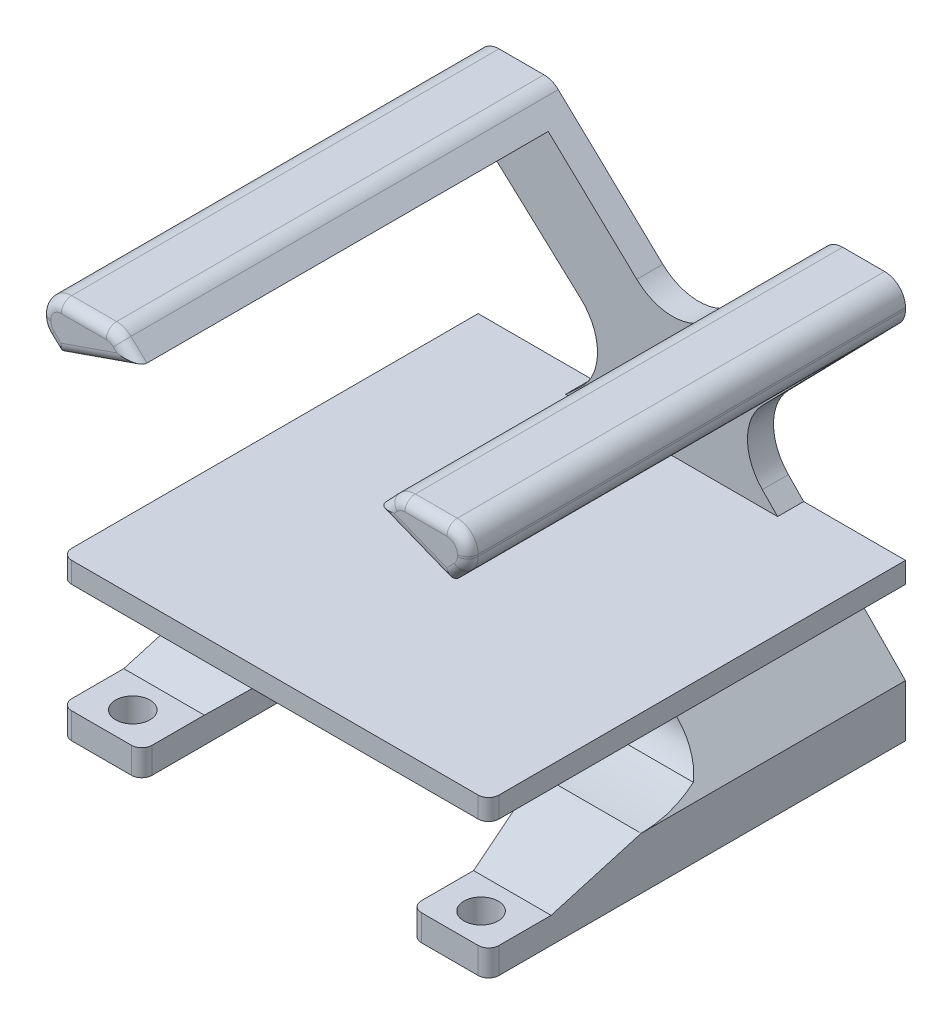
from build123d import *
from OCP.BRepFilletAPI import BRepFilletAPI_MakeChamfer

# Parameters (mm, degrees)
BOSS_EXTRUDE1_DEPTH = 40
SKETCH3_W           = 37.5
SKETCH3_H           = 21
SKETCH3_W_2         = 41
SKETCH3_H_2         = 2
CUT_EXTRUDE1_DEPTH  = 37.5
SKETCH4_W           = 50.283363854
SKETCH4_H           = 54.333359839
CUT_EXTRUDE2_DEPTH  = 37.5
BOSS_EXTRUDE2_DEPTH = 2
SKETCH6_W           = 30
SKETCH6_H           = 8
CUT_EXTRUDE3_DEPTH  = 100
CHAMFER1_SIZE       = 10
CHAMFER1_SIZE2      = 5.773502692
FILLET2_R           = 20
FILLET3_R           = 4
FILLET4_R           = 5
CUT_EXTRUDE4_DEPTH  = 100
BOSS_EXTRUDE3_REACH = 51.556
SKETCH9_R           = 1.65
CUT_EXTRUDE5_DEPTH  = 100
SKETCH10_W          = 7
SKETCH10_H          = 2.5
BOSS_EXTRUDE4_DEPTH = 5
SKETCH11_R          = 1.65
CUT_EXTRUDE6_DEPTH  = 5
FILLET5_R           = 1
FILLET6_R           = 1
FILLET7_R           = 2
FILLET8_R           = 1
FILLET9_R           = 1


with BuildPart() as part:
    # Sketch2 → Boss-Extrude1 (new body)
    with BuildSketch(Plane.XY):
        Polygon((-2.179971033, -7), (-16.349782749, -20), (-21.349782749, -20), (-21.349782749, -15), (-12.629898616, -7), (-21.349782749, -7), (-21.349782749, -5), (-10.449927583, -5), (-5, 0), (-21.349782749, 15), (-21.349782749, 20), (-16.349782749, 20), (0, 4.52331207), (14.650217251, 20), (19.650217251, 20), (19.650217251, 15), (5, 0), (9.88340575, -5), (19.650217251, -5), (19.650217251, -7), (11.83676805, -7), (19.650217251, -15), (19.650217251, -20), (14.650217251, -20), (1.9533623, -7), align=None)
    extrude(amount=BOSS_EXTRUDE1_DEPTH)

    # Sketch3 → Cut-Extrude1 (cut)
    with BuildSketch(Plane.XY.offset(40)):
        with Locations((-0.849782749, 5.5)):
            Rectangle(SKETCH3_W, SKETCH3_H)
        with Locations((-0.849782749, 19)):
            Rectangle(SKETCH3_W_2, SKETCH3_H_2)
    extrude(amount=-CUT_EXTRUDE1_DEPTH, mode=Mode.SUBTRACT)

    # Sketch4 → Cut-Extrude2 (cut)
    with BuildSketch(Plane(origin=(0, 18, 0), x_dir=(1, 0, 0), z_dir=(0, 1, 0))):
        with Locations((3.791899178, 24.66667992)):
            Rectangle(SKETCH4_W, SKETCH4_H)
    extrude(amount=CUT_EXTRUDE2_DEPTH, mode=Mode.SUBTRACT)

    # Sketch5 → Boss-Extrude2 (add)
    with BuildSketch(Plane.XY.offset(40)):
        Polygon((-21.349782749, 15), (-19.599782749, 13.394474079), (-12.124128572, 16), (-14.236955661, 18), (-21.349782749, 18), align=None)
        Polygon((10.863821268, 16), (12.75701926, 18), (19.650217251, 18), (19.650217251, 15), (17.900217251, 13.208217697), align=None)
    extrude(amount=BOSS_EXTRUDE2_DEPTH)

    # Sketch6 → Cut-Extrude3 (cut)
    with BuildSketch(Plane(origin=(19.650217251, 0, 0), x_dir=(0, 0, -1), z_dir=(1, 0, 0))):
        with Locations((-25, -11)):
            Rectangle(SKETCH6_W, SKETCH6_H)
    extrude(amount=-CUT_EXTRUDE3_DEPTH, mode=Mode.SUBTRACT)

    # Chamfer1: one chamfer whose edges measure the first distance from different faces: ONE call of the kernel's chamfer builder (chamfer() names one face for all edges)
    chamfer1_edges_1 = [part.edges().sort_by_distance(p)[0] for p in [
        (-16.124818958, -15, 10),
    ]]
    chamfer1_side_1 = [part.faces().sort_by_distance(p)[0] for p in [
        (-16.124818958, -15, 25),
    ]]
    chamfer1_edges_2 = [part.edges().sort_by_distance(p)[0] for p in [
        (14.708514376, -15, 10),
    ]]
    chamfer1_side_2 = [part.faces().sort_by_distance(p)[0] for p in [
        (14.708514376, -15, 25),
    ]]
    chamfer1 = BRepFilletAPI_MakeChamfer(part.part.solid().wrapped)
    for e in chamfer1_edges_1:
        chamfer1.Add(CHAMFER1_SIZE, CHAMFER1_SIZE2, e.wrapped, chamfer1_side_1[0].wrapped)  # the first distance lies on this face
    for e in chamfer1_edges_2:
        chamfer1.Add(CHAMFER1_SIZE, CHAMFER1_SIZE2, e.wrapped, chamfer1_side_2[0].wrapped)  # the first distance lies on this face
    add(Compound.cast(chamfer1.Shape()), mode=Mode.REPLACE)

    # Fillet2
    # the kernel refuses this fillet: 20 mm, written as the material it adds along each edge
    with BuildSketch(Plane(origin=(14.02999004, -9.226497308, 10), x_dir=(0, 1, 0), z_dir=(-1, 0, 0))) as fillet2_piece_1_section:
        with BuildLine():
            CenterArc((13.593145897, -16.455980671), FILLET2_R, 124.634022664, 25.365977336)
            Line((-3.727362178, -6.455980671), (0, 0))
            Line((0, 0), (2.226497308, 0))
        make_face()
    fillet2_piece_1 = extrude(amount=47.723549367, mode=Mode.PRIVATE)
    fillet2_piece_1 = split(fillet2_piece_1, bisect_by=Plane(origin=(14.020448108, -9.235816733, 10), z_dir=(-0.7153987205247665, -0.6987164451131282, 0)), keep=Keep.TOP, mode=Mode.PRIVATE)
    fillet2_piece_1 = split(fillet2_piece_1, bisect_by=Plane(origin=(8.962167208, -14.17614434, 10), z_dir=(0.7153987205247687, 0.6987164451131259, 0)), keep=Keep.TOP, mode=Mode.PRIVATE)
    add(fillet2_piece_1)
    with BuildSketch(Plane(origin=(14.02999004, -9.226497308, 10), x_dir=(0, 1, 0), z_dir=(-1, 0, 0))) as fillet2_piece_2_section:
        with BuildLine():
            CenterArc((13.593145897, -16.455980671), FILLET2_R, 124.634022664, 25.365977336)
            Line((-3.727362178, -6.455980671), (0, 0))
            Line((0, 0), (2.226497308, 0))
        make_face()
    fillet2_piece_2 = extrude(amount=47.723549367, mode=Mode.PRIVATE)
    fillet2_piece_2 = split(fillet2_piece_2, bisect_by=Plane(origin=(5.512518344, 0.057423479, 10), z_dir=(-0.6760355748646789, 0.7368689853137959, 0)), keep=Keep.TOP, mode=Mode.PRIVATE)
    fillet2_piece_2 = split(fillet2_piece_2, bisect_by=Plane(origin=(0.736649611, 5.263051227, 10), z_dir=(0.6760355748646789, -0.7368689853137959, 0)), keep=Keep.TOP, mode=Mode.PRIVATE)
    add(fillet2_piece_2)
    with BuildSketch(Plane(origin=(2.497604455, -15, 20), x_dir=(0, 0.5000000000000009, -0.866025403784438), z_dir=(-1, 0, 0))) as fillet2_piece_3_section:
        with BuildLine():
            CenterArc((FILLET2_R * 0.267949192431, -FILLET2_R), FILLET2_R, 90, 30)
            Line((-FILLET2_R * 0.232050807569, -FILLET2_R * 0.133974596216), (0, 0))
            Line((0, 0), (FILLET2_R * 0.267949192431, 0))
        make_face()
    fillet2_piece_3 = extrude(amount=37.244846826, mode=Mode.PRIVATE)
    fillet2_piece_3 = split(fillet2_piece_3, bisect_by=Plane(origin=(-3.62535745, -8.326060204, 20), z_dir=(-0.6760355748646789, 0.7368689853137959, 0)), keep=Keep.TOP, mode=Mode.PRIVATE)
    fillet2_piece_3 = split(fillet2_piece_3, bisect_by=Plane(origin=(-8.401226183, -3.120432456, 20), z_dir=(0.6760355748646789, -0.7368689853137959, 0)), keep=Keep.TOP, mode=Mode.PRIVATE)
    add(fillet2_piece_3)
    with BuildSketch(Plane(origin=(32.648156894, -9.226497308, 10), x_dir=(0, -0.5000000000000011, 0.8660254037844379), z_dir=(-1, 0, 0))) as fillet2_piece_4_section:
        with BuildLine():
            CenterArc((7.454724357, 20), FILLET2_R, 244.634022664, 25.365977336)
            Line((-1.113248654, 1.92820323), (0, 0))
            Line((0, 0), (7.454724357, 0))
        make_face()
    fillet2_piece_4 = extrude(amount=47.157027534, mode=Mode.PRIVATE)
    fillet2_piece_4 = split(fillet2_piece_4, bisect_by=Plane(origin=(23.109924126, -18.542309458, 10), z_dir=(-0.7153987205247665, -0.6987164451131282, 0)), keep=Keep.TOP, mode=Mode.PRIVATE)
    fillet2_piece_4 = split(fillet2_piece_4, bisect_by=Plane(origin=(18.051643225, -23.482637065, 10), z_dir=(0.7153987205247687, 0.6987164451131259, 0)), keep=Keep.TOP, mode=Mode.PRIVATE)
    add(fillet2_piece_4)
    with BuildSketch(Plane(origin=(32.648156894, -9.226497308, 10), x_dir=(0, -0.5000000000000011, 0.8660254037844379), z_dir=(-1, 0, 0))) as fillet2_piece_5_section:
        with BuildLine():
            CenterArc((7.454724357, 20), FILLET2_R, 244.634022664, 25.365977336)
            Line((-1.113248654, 1.92820323), (0, 0))
            Line((0, 0), (7.454724357, 0))
        make_face()
    fillet2_piece_5 = extrude(amount=47.157027534, mode=Mode.PRIVATE)
    fillet2_piece_5 = split(fillet2_piece_5, bisect_by=Plane(origin=(15.621734276, 9.332056745, 10), z_dir=(-0.6760355748646789, 0.7368689853137959, 0)), keep=Keep.TOP, mode=Mode.PRIVATE)
    fillet2_piece_5 = split(fillet2_piece_5, bisect_by=Plane(origin=(10.845865543, 14.537684493, 10), z_dir=(0.6760355748646789, -0.7368689853137959, 0)), keep=Keep.TOP, mode=Mode.PRIVATE)
    add(fillet2_piece_5)
    with BuildSketch(Plane(origin=(33.047676872, -15, 20), x_dir=(0, 0.5000000000000009, -0.866025403784438), z_dir=(-1, 0, 0))) as fillet2_piece_6_section:
        with BuildLine():
            CenterArc((FILLET2_R * 0.267949192431, -FILLET2_R), FILLET2_R, 90, 30)
            Line((-FILLET2_R * 0.232050807569, -FILLET2_R * 0.133974596216), (0, 0))
            Line((0, 0), (FILLET2_R * 0.267949192431, 0))
        make_face()
    fillet2_piece_6 = extrude(amount=36.678324993, mode=Mode.PRIVATE)
    fillet2_piece_6 = split(fillet2_piece_6, bisect_by=Plane(origin=(26.190919613, -21.696865566, 20), z_dir=(-0.7153987205247665, -0.6987164451131282, 0)), keep=Keep.TOP, mode=Mode.PRIVATE)
    fillet2_piece_6 = split(fillet2_piece_6, bisect_by=Plane(origin=(21.132638712, -26.637193173, 20), z_dir=(0.7153987205247687, 0.6987164451131259, 0)), keep=Keep.TOP, mode=Mode.PRIVATE)
    add(fillet2_piece_6)

    # Fillet3
    # the kernel refuses this fillet: 4 mm, written as the material it adds along each edge
    with BuildSketch(Plane(origin=(45.374542852, -7, 10), x_dir=(0, -0.5845395374156303, 0.8113652255291207), z_dir=(-1, 0, 0))) as fillet3_piece_1_section:
        with BuildLine():
            CenterArc((12.073598928, 3.768334945), FILLET3_R, 125.7704671, 163.825043137)
            Line((9.735440779, 7.013795847), (0, 0))
            ThreePointArc((0, 0), (6.70755496, -1.158325275), (13.41510992, 0))
        make_face()
    fillet3_piece_1 = extrude(amount=76.958955353, mode=Mode.PRIVATE)
    fillet3_piece_1 = split(fillet3_piece_1, bisect_by=Plane(origin=(23.151785451, -28.704548255, 10), z_dir=(0.7153987205249446, 0.6987164451129458, 0)), keep=Keep.TOP, mode=Mode.PRIVATE)
    fillet3_piece_1 = split(fillet3_piece_1, bisect_by=Plane(origin=(28.210066352, -23.764220648, 10), z_dir=(-0.7153987205249446, -0.6987164451129458, 0)), keep=Keep.TOP, mode=Mode.PRIVATE)
    add(fillet3_piece_1)
    with BuildSketch(Plane(origin=(45.374542852, -7, 10), x_dir=(0, -0.5845395374156303, 0.8113652255291207), z_dir=(-1, 0, 0))) as fillet3_piece_2_section:
        with BuildLine():
            CenterArc((12.073598928, 3.768334945), FILLET3_R, 125.7704671, 163.825043137)
            Line((9.735440779, 7.013795847), (0, 0))
            ThreePointArc((0, 0), (6.70755496, -1.158325275), (13.41510992, 0))
        make_face()
    fillet3_piece_2 = extrude(amount=76.958955353, mode=Mode.PRIVATE)
    fillet3_piece_2 = split(fillet3_piece_2, bisect_by=Plane(origin=(23.640984015, 16.689264357, 10), z_dir=(-0.6760355748647515, 0.7368689853137292, 0)), keep=Keep.TOP, mode=Mode.PRIVATE)
    fillet3_piece_2 = split(fillet3_piece_2, bisect_by=Plane(origin=(18.865115282, 21.894892105, 10), z_dir=(0.6760355748647515, -0.7368689853137292, 0)), keep=Keep.TOP, mode=Mode.PRIVATE)
    add(fillet3_piece_2)
    with BuildSketch(Plane(origin=(31.357803768, -7, 10), x_dir=(0, 0, 1), z_dir=(-1, 0, 0))) as fillet3_piece_3_section:
        with BuildLine():
            CenterArc((11.998839083, -4), FILLET3_R, 90, 163.825043137)
            ThreePointArc((10.884553686, -7.841662147), (4.765189923, -4.860655921), (0, 0))
            Line((0, 0), (11.998839083, 0))
        make_face()
    fillet3_piece_3 = extrude(amount=77.525477185, mode=Mode.PRIVATE)
    fillet3_piece_3 = split(fillet3_piece_3, bisect_by=Plane(origin=(16.308747963, -21.698129131, 10), z_dir=(0.7153987205249446, 0.6987164451129458, 0)), keep=Keep.TOP, mode=Mode.PRIVATE)
    fillet3_piece_3 = split(fillet3_piece_3, bisect_by=Plane(origin=(21.367028864, -16.757801523, 10), z_dir=(-0.7153987205249446, -0.6987164451129458, 0)), keep=Keep.TOP, mode=Mode.PRIVATE)
    add(fillet3_piece_3)
    with BuildSketch(Plane(origin=(31.357803768, -7, 10), x_dir=(0, 0, 1), z_dir=(-1, 0, 0))) as fillet3_piece_4_section:
        with BuildLine():
            CenterArc((11.998839083, -4), FILLET3_R, 90, 163.825043137)
            ThreePointArc((10.884553686, -7.841662147), (4.765189923, -4.860655921), (0, 0))
            Line((0, 0), (11.998839083, 0))
        make_face()
    fillet3_piece_4 = extrude(amount=77.525477185, mode=Mode.PRIVATE)
    fillet3_piece_4 = split(fillet3_piece_4, bisect_by=Plane(origin=(11.254363742, 14.912458463, 10), z_dir=(0.6760355748647515, -0.7368689853137292, 0)), keep=Keep.TOP, mode=Mode.PRIVATE)
    fillet3_piece_4 = split(fillet3_piece_4, bisect_by=Plane(origin=(16.030232474, 9.706830715, 10), z_dir=(-0.6760355748647515, 0.7368689853137292, 0)), keep=Keep.TOP, mode=Mode.PRIVATE)
    add(fillet3_piece_4)

    # Fillet4
    fillet4_edges = [part.edges().sort_by_distance(p)[0] for p in [
        (1.9533623, -7, 10.999419542),
        (-2.179971033, -7, 10.999419542),
        (0, 4.52331207, 1.25),
        (-5, 0, 1.25),
        (5, 0, 1.25),
    ]]
    fillet(fillet4_edges, radius=FILLET4_R)

    # Sketch7 → Cut-Extrude4 (cut)
    with BuildSketch(Plane(origin=(19.650217251, 0, 0), x_dir=(0, 0, -1), z_dir=(1, 0, 0))):
        Polygon((-40, -17.5), (-34, -17.5), (-25.358983849, -15), (-40, -15), align=None)
    extrude(amount=-CUT_EXTRUDE4_DEPTH, mode=Mode.SUBTRACT)

    # Boss-Extrude3: up to this face of the body (flat: up to its plane)
    boss_extrude3_end = Plane(part.part.faces().sort_by_distance((-0.697208097, -1.016556484, 0))[0])
    # Sketch8 → Boss-Extrude3 (add, up to the picked face)
    with BuildSketch(Plane.XY.offset(40), mode=Mode.PRIVATE) as boss_extrude3_sk1:
        Polygon((-13.624818958, -17.5), (-16.349782749, -20), (-13.624818958, -20), align=None)
    boss_extrude3_tool1 = split(extrude(boss_extrude3_sk1.sketch, amount=-BOSS_EXTRUDE3_REACH, mode=Mode.PRIVATE), bisect_by=boss_extrude3_end, keep=Keep.BOTH, mode=Mode.PRIVATE)
    # Sketch8 → Boss-Extrude3 (add, up to the picked face)
    with BuildSketch(Plane.XY.offset(40), mode=Mode.PRIVATE) as boss_extrude3_sk2:
        Polygon((14.650217251, -20), (12.208514376, -17.5), (12.208514376, -20), align=None)
    boss_extrude3_tool2 = split(extrude(boss_extrude3_sk2.sketch, amount=-BOSS_EXTRUDE3_REACH, mode=Mode.PRIVATE), bisect_by=boss_extrude3_end, keep=Keep.BOTH, mode=Mode.PRIVATE)
    add(boss_extrude3_tool1.solids().sort_by(Axis((-14.53314, -19.166667, 40), (0, 0, -1)))[0])
    add(boss_extrude3_tool2.solids().sort_by(Axis((13.022415, -19.166667, 40), (0, 0, -1)))[0])

    # Sketch9 → Cut-Extrude5 (cut)
    with BuildSketch(Plane(origin=(0, -17.5, 0), x_dir=(1, 0, 0), z_dir=(0, 1, 0))):
        with Locations(Location((-17.487300853, -37, 0), (0, 0, 270))):
            Circle(SKETCH9_R)
        with Locations(Location((15.929365813, -37, 0), (0, 0, 270))):
            Circle(SKETCH9_R)
    extrude(amount=-CUT_EXTRUDE5_DEPTH, mode=Mode.SUBTRACT)

    # Sketch10 → Boss-Extrude4 (add)
    with BuildSketch(Plane(origin=(0, 0, 0), x_dir=(-1, 0, 0), z_dir=(0, 0, -1))):
        with Locations((10.124818958, -18.75)):
            Rectangle(SKETCH10_W, SKETCH10_H)
        with Locations((-8.708514376, -18.75)):
            Rectangle(SKETCH10_W, SKETCH10_H)
    extrude(amount=-BOSS_EXTRUDE4_DEPTH)

    # Sketch11 → Cut-Extrude6 (cut)
    with BuildSketch(Plane(origin=(0, -17.5, 0), x_dir=(1, 0, 0), z_dir=(0, 1, 0))):
        with Locations(Location((8.208514376, -2.5, 0), (0, 0, 270))):
            Circle(SKETCH11_R)
        with Locations(Location((-9.624818958, -2.5, 0), (0, 0, 270))):
            Circle(SKETCH11_R)
    extrude(amount=-CUT_EXTRUDE6_DEPTH, mode=Mode.SUBTRACT)

    # Fillet5
    fillet5_edges = [part.edges().sort_by_distance(p)[0] for p in [
        (5.208514376, -18.75, 5),
        (-6.624818958, -18.75, 5),
    ]]
    fillet(fillet5_edges, radius=FILLET5_R)

    # Fillet6
    fillet6_edges = [part.edges().sort_by_distance(p)[0] for p in [
        (19.650217251, -6, 40),
        (-21.349782749, -6, 40),
    ]]
    fillet(fillet6_edges, radius=FILLET6_R)

    # Fillet7
    fillet7_edges = [part.edges().sort_by_distance(p)[0] for p in [
        (12.75701926, 18, 21),
        (-14.236955661, 18, 21),
        (19.650217251, 18, 21),
        (-21.349782749, 18, 21),
        (-21.349782749, 15, 21),
        (19.650217251, 15, 21),
    ]]
    fillet(fillet7_edges, radius=FILLET7_R)

    # Fillet8
    fillet8_edges = [part.edges().sort_by_distance(p)[0] for p in [
        (-15.861955661, 14.69723704, 42),
        (-12.891329478, 16.726231607, 42),
        (14.38201926, 14.604108849, 42),
        (18.490615971, 13.812712542, 42),
        (19.650217251, 15.907320139, 42),
        (15.63399045, 18, 42),
        (11.514560852, 16.68745011, 42),
        (12.827131129, 17.83709015, 42),
        (19.502458445, 15.060185137, 42),
        (19.064430813, 17.414213562, 42),
        (-20.150818324, 13.900018021, 42),
        (-21.349782749, 15.939649967, 42),
        (-17.191606676, 18, 42),
        (-20.763996311, 17.414213562, 42),
        (-14.293473316, 17.858080519, 42),
        (-21.180648978, 15.074359657, 42),
    ]]
    fillet(fillet8_edges, radius=FILLET8_R)

    # Fillet9
    fillet9_edges = [part.edges().sort_by_distance(p)[0] for p in [
        (19.650217251, -18.75, 40),
        (-13.624818958, -18.75, 40),
        (12.208514376, -18.75, 40),
        (-21.349782749, -18.75, 40),
    ]]
    fillet(fillet9_edges, radius=FILLET9_R)


solid = part.part
